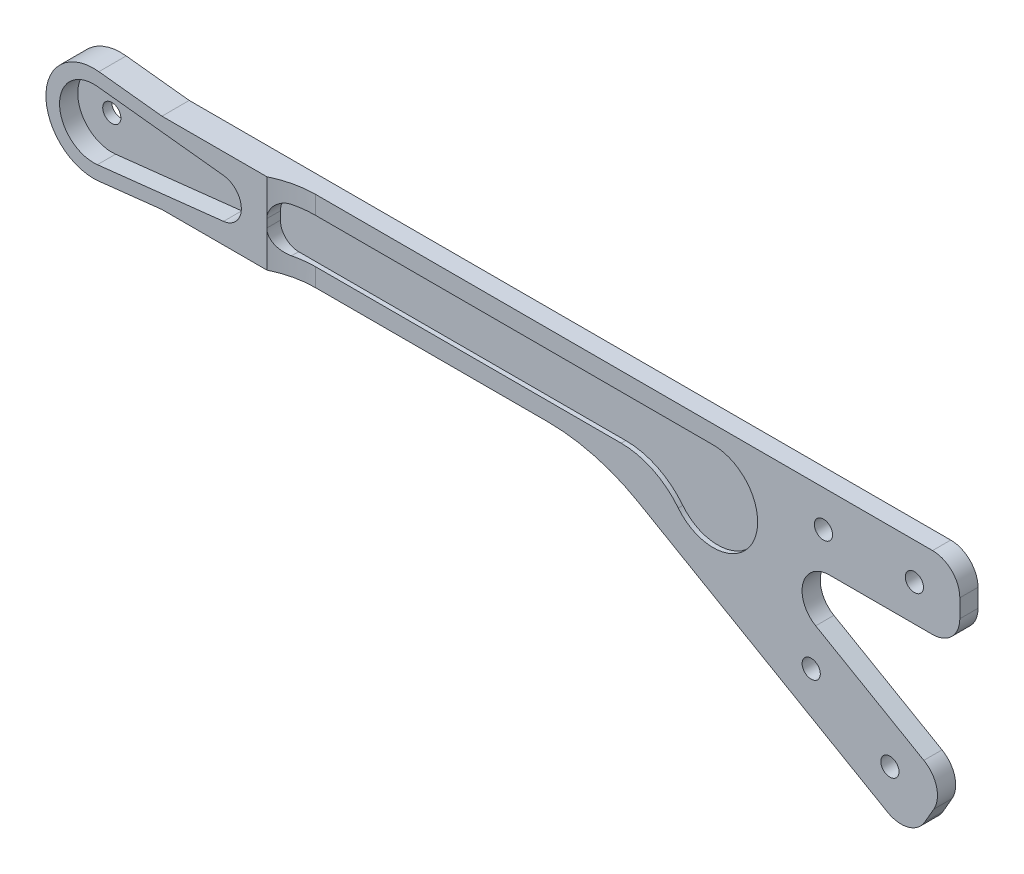
from build123d import *

# Parameters (mm, degrees)
BOSS_EXTRUDE1_DEPTH      = 2
BOSS_EXTRUDE2_DEPTH      = 1
SKETCH3_R                = 1
CUT_EXTRUDE1_DEPTH       = 1
BOSS_EXTRUDE3_DEPTH      = 2
BOSS_EXTRUDE3_DEPTH_BACK = 1
BOSS_EXTRUDE4_START      = -3
BOSS_EXTRUDE4_OUTLINE_R  = 1
BOSS_EXTRUDE4_DEPTH      = 3
SKETCH6_R                = 3.500627768
BOSS_EXTRUDE5_DEPTH      = 3
BOSS_EXTRUDE6_DEPTH      = 3
CUT_EXTRUDE2_DEPTH       = 15
FILLET1_R                = 20
FILLET2_R                = 3
FILLET3_R                = 3
SKETCH9_R                = 1
CUT_EXTRUDE3_DEPTH       = 15
CUT_EXTRUDE4_DEPTH       = 1.5
FILLET4_R                = 8
FILLET5_R                = 2
SKETCH11_W               = 110.258684369
SKETCH11_H               = 6.064888907
CUT_EXTRUDE5_DEPTH       = 38
SKETCH12_R               = 18.613151801
CUT_EXTRUDE6_DEPTH       = 29
SKETCH13_W               = 77.706478895
SKETCH13_H               = 41.021519778
CUT_EXTRUDE7_DEPTH       = 1
FILLET6_START            = -4.447684996
FILLET6_DEPTH            = 2
FILLET6_START_2          = 2.447684996
FILLET6_2_DEPTH          = 2
FILLET6_START_3          = -1
FILLET6_3_DEPTH          = 1
FILLET6_START_4          = -2.447684996
FILLET6_4_DEPTH          = 4.895369992


with BuildPart() as part:
    # Sketch1 → Boss-Extrude1 (new body)
    with BuildSketch(Plane.XY):
        with BuildLine():
            Line((14.458185053, 3.677415528), (0.579181495, 5.217954465))
            ThreePointArc((0.579181495, 5.217954465), (-5.25, 0), (0.579181495, -5.217954465))
            Line((0.579181495, -5.217954465), (14.458185053, -3.677415528))
            ThreePointArc((14.458185053, -3.677415528), (17.75, 0), (14.458185053, 3.677415528))
        make_face()
        with BuildLine():
            Line((14.292704626, 2.186571395), (0.413701068, 3.727110332))
            ThreePointArc((0.413701068, 3.727110332), (-3.75, 0), (0.413701068, -3.727110332))
            Line((0.413701068, -3.727110332), (14.292704626, -2.186571395))
            ThreePointArc((14.292704626, -2.186571395), (16.25, 0), (14.292704626, 2.186571395))
        make_face(mode=Mode.SUBTRACT)
    extrude(amount=BOSS_EXTRUDE1_DEPTH)

    # Sketch2 → Boss-Extrude2 (add)
    with BuildSketch(Plane.XY.offset(2)):
        with BuildLine():
            Line((14.458185053, 3.677415528), (0.579181495, 5.217954465))
            ThreePointArc((0.579181495, 5.217954465), (-5.25, 0), (0.579181495, -5.217954465))
            Line((0.579181495, -5.217954465), (14.458185053, -3.677415528))
            ThreePointArc((14.458185053, -3.677415528), (17.75, 0), (14.458185053, 3.677415528))
        make_face()
    extrude(amount=BOSS_EXTRUDE2_DEPTH)

    # Sketch3 → Cut-Extrude1 (cut)
    with BuildSketch(Plane.XY.offset(3)):
        Circle(SKETCH3_R)
    extrude(amount=-CUT_EXTRUDE1_DEPTH, mode=Mode.SUBTRACT)

    # Sketch4 → Boss-Extrude3 (add, two sides: drawn at the far end of the back side and taken through both)
    with BuildSketch(Plane(origin=(0, 0, 2), x_dir=(-1, 0, 0), z_dir=(0, 0, -1)).offset(-BOSS_EXTRUDE3_DEPTH_BACK)):
        with BuildLine():
            Line((-15.26072202, 2.426182253), (-7.518683274, 4.447684996))
            Line((-7.518683274, 4.447684996), (-42.518683274, 4.447684996))
            ThreePointArc((-42.518683274, 4.447684996), (-39.373695053, 3.144988221), (-38.070998278, 0))
            ThreePointArc((-38.070998278, 0), (-39.373695053, -3.144988221), (-42.518683274, -4.447684996))
            Line((-42.518683274, -4.447684996), (-7.518683274, -4.447684996))
            Line((-7.518683274, -4.447684996), (-13.862339481, -2.595687971))
            Line((-13.862339481, -2.595687971), (-16.213670101, -1.84565397))
            Line((-16.213670101, -1.84565397), (-17.166618181, 0))
            Line((-17.166618181, 0), (-15.26072202, 2.426182253))
        make_face()
        with BuildLine():
            ThreePointArc((-38.070998278, 0), (-39.373695053, 3.144988221), (-42.518683274, 4.447684996))
            Line((-42.518683274, 4.447684996), (-42.518683274, 2))
            ThreePointArc((-42.518683274, 2), (-41.104469712, 1.414213562), (-40.518683274, 0))
            ThreePointArc((-40.518683274, 0), (-41.104469712, -1.414213562), (-42.518683274, -2))
            Line((-42.518683274, -2), (-42.518683274, -4.447684996))
            ThreePointArc((-42.518683274, -4.447684996), (-39.373695053, -3.144988221), (-38.070998278, 0))
        make_face()
        with BuildLine():
            Line((-42.518683274, 2), (-42.518683274, 4.447684996))
            ThreePointArc((-42.518683274, 4.447684996), (-46.96636827, 0), (-42.518683274, -4.447684996))
            Line((-42.518683274, -4.447684996), (-42.518683274, -2))
            ThreePointArc((-42.518683274, -2), (-44.518683274, 0), (-42.518683274, 2))
        make_face()
    extrude(amount=BOSS_EXTRUDE3_DEPTH + BOSS_EXTRUDE3_DEPTH_BACK)

    # Boss-Extrude4: read off the stored shape, not the designer's step
    # Boss-Extrude4 outline → Boss-Extrude4 (add)
    with BuildSketch(Plane(origin=(0, 0, 0), x_dir=(-1, 0, 0), z_dir=(0, 0, -1)).offset(BOSS_EXTRUDE4_START)):
        with BuildLine():
            ThreePointArc((-42.518683274, -4.447684996), (-46.96636827, 0), (-42.518683274, 4.447684996))
            Line((-42.518683274, 4.447684996), (-54.290526798, 4.447684996))
            ThreePointArc((-54.290526798, 4.447684996), (-59.289068337, 5.305033813), (-63.716210719, 7.779073998))
            ThreePointArc((-63.716210719, 7.779073998), (-80, 0), (-63.716210719, -7.779073998))
            ThreePointArc((-63.716210719, -7.779073998), (-59.289068337, -5.305033813), (-54.290526798, -4.447684996))
            Line((-54.290526798, -4.447684996), (-42.518683274, -4.447684996))
        make_face()
        with Locations((-68.205771366, -4.5)):
            Circle(BOSS_EXTRUDE4_OUTLINE_R, mode=Mode.SUBTRACT)
        with Locations((-76, 0)):
            Circle(BOSS_EXTRUDE4_OUTLINE_R, mode=Mode.SUBTRACT)
        with Locations((-68.205771366, 4.5)):
            Circle(BOSS_EXTRUDE4_OUTLINE_R, mode=Mode.SUBTRACT)
    extrude(amount=BOSS_EXTRUDE4_DEPTH)

    # Sketch6 → Boss-Extrude5 (add)
    with BuildSketch(Plane(origin=(0, 0, 0), x_dir=(-1, 0, 0), z_dir=(0, 0, -1))):
        with Locations((-42.518683274, 0)):
            Circle(SKETCH6_R)
    extrude(amount=-BOSS_EXTRUDE5_DEPTH)

    # Sketch7 → Boss-Extrude6 (add)
    with BuildSketch(Plane(origin=(0, 0, 0), x_dir=(-1, 0, 0), z_dir=(0, 0, -1))):
        Polygon((-54.290526798, 4.447684996), (-94.290526798, 4.447684996), (-94.290526798, -3.552315004), (-68.73970048, -3.552315004), (-92.931542949, -17.519481766), (-88.931542949, -24.447684996), (-54.290526798, -4.447684996), align=None)
    extrude(amount=-BOSS_EXTRUDE6_DEPTH)

    # Sketch8 → Cut-Extrude2 (cut)
    with BuildSketch(Plane(origin=(0, 0, 0), x_dir=(-1, 0, 0), z_dir=(0, 0, -1))):
        Polygon((-94.290526798, 4.447684996), (-45.837456427, 4.447684996), (-68.326886593, 15.265325323), align=None)
        Polygon((-94.290526798, -3.552315004), (-68.73970048, -3.552315004), (-92.931542949, -17.519481766), align=None)
    extrude(amount=-CUT_EXTRUDE2_DEPTH, mode=Mode.SUBTRACT)

    # Fillet1
    fillet1_edges = [part.edges().sort_by_distance(p)[0] for p in [
        (54.290526798, -4.447684996, 1.5),
    ]]
    fillet(fillet1_edges, radius=FILLET1_R)

    # Fillet2
    fillet2_edges = [part.edges().sort_by_distance(p)[0] for p in [
        (94.290526798, 4.447684996, 1.5),
        (94.290526798, -3.552315004, 1.5),
        (92.931542949, -17.519481766, 1.5),
        (88.931542949, -24.447684996, 1.5),
    ]]
    fillet(fillet2_edges, radius=FILLET2_R)

    # Fillet3
    fillet3_edges = [part.edges().sort_by_distance(p)[0] for p in [
        (68.73970048, -3.552315004, 1.5),
    ]]
    fillet(fillet3_edges, radius=FILLET3_R)

    # Sketch9 → Cut-Extrude3 (cut)
    with BuildSketch(Plane(origin=(0, 0, 0), x_dir=(-1, 0, 0), z_dir=(0, 0, -1))):
        with Locations((-89.290526798, 0.447684996)):
            Circle(SKETCH9_R)
        with Locations((-79.290526798, 0.447684996)):
            Circle(SKETCH9_R)
        with Locations((-77.941161892, -13.483583381)):
            Circle(SKETCH9_R)
        with Locations((-86.60141593, -18.483583381)):
            Circle(SKETCH9_R)
    extrude(amount=-CUT_EXTRUDE3_DEPTH, mode=Mode.SUBTRACT)

    # Sketch10 → Cut-Extrude4 (cut)
    with BuildSketch(Plane(origin=(0, 0, 0), x_dir=(-1, 0, 0), z_dir=(0, 0, -1))):
        with BuildLine():
            Line((-19.05, 2.447684996), (-67.154630008, 2.447684996))
            ThreePointArc((-67.154630008, 2.447684996), (-70.616179326, -5.909234314), (-62.259260015, -2.447684996))
            Line((-62.259260015, -2.447684996), (-19.05, -2.447684996))
            Line((-19.05, -2.447684996), (-19.05, 2.447684996))
        make_face()
    extrude(amount=-CUT_EXTRUDE4_DEPTH, mode=Mode.SUBTRACT)

    # Fillet4
    fillet4_edges = [part.edges().sort_by_distance(p)[0] for p in [
        (62.259260015, -2.447684996, 0.75),
    ]]
    fillet(fillet4_edges, radius=FILLET4_R)

    # Fillet5
    fillet5_edges = [part.edges().sort_by_distance(p)[0] for p in [
        (19.05, 2.447684996, 0.75),
        (19.05, -2.447684996, 0.75),
    ]]
    fillet(fillet5_edges, radius=FILLET5_R)

    # Mirror1: part across plane


with BuildPart() as part_1:
    add(part.part)
    add(part.part.mirror(Plane(origin=(14.05, 0, 0), x_dir=(1, 0, 0), z_dir=(0, 0, 1))))

    # Sketch11 → Cut-Extrude5 (cut)
    with BuildSketch(Plane(origin=(0, 4.447684996, 0), x_dir=(1, 0, 0), z_dir=(0, 1, 0))):
        with Locations((47.771534573, -3.032444454)):
            Rectangle(SKETCH11_W, SKETCH11_H)
    extrude(amount=-CUT_EXTRUDE5_DEPTH, mode=Mode.SUBTRACT)

    # Sketch12 → Cut-Extrude6 (cut)
    with BuildSketch(Plane.XY):
        with Locations((7.534351793, 3.599902348)):
            Circle(SKETCH12_R)
    extrude(amount=CUT_EXTRUDE6_DEPTH, mode=Mode.SUBTRACT)

    # Sketch13 → Cut-Extrude7 (cut)
    with BuildSketch(Plane.XY):
        with Locations((57.903239447, -8.718962854)):
            Rectangle(SKETCH13_W, SKETCH13_H)
    extrude(amount=-CUT_EXTRUDE7_DEPTH, mode=Mode.SUBTRACT)

    # Fillet6: read off the stored shape, not the designer's step
    # Fillet6 outline → Fillet6 (add)
    with BuildSketch(Plane(origin=(0, 0, 0), x_dir=(1, 0, 0), z_dir=(0, 1, 0)).offset(FILLET6_START)):
        with BuildLine():
            Line((19.05, 1), (19.049997006, -1.45e-06))
            ThreePointArc((19.049997006, -1.45e-06), (21.172829345, 0.746793973), (23.408898944, 1))
            Line((23.408898944, 1), (19.05, 1))
        make_face()
    extrude(amount=FILLET6_DEPTH)

    # Fillet6 2 outline → Fillet6 2 (add)
    with BuildSketch(Plane(origin=(0, 0, 0), x_dir=(1, 0, 0), z_dir=(0, 1, 0)).offset(FILLET6_START_2)):
        with BuildLine():
            Line((19.05, 1), (19.049997006, -1.45e-06))
            ThreePointArc((19.049997006, -1.45e-06), (21.172829345, 0.746793973), (23.408898944, 1))
            Line((23.408898944, 1), (19.05, 1))
        make_face()
    extrude(amount=FILLET6_2_DEPTH)

    # Fillet6 3 outline → Fillet6 3 (add)
    with BuildSketch(Plane.XY.offset(FILLET6_START_3)):
        with BuildLine():
            Line((19.05, 2.447684996), (19.05, 0.447684996))
            ThreePointArc((19.05, 0.447684996), (19.635786438, 1.861898559), (21.05, 2.447684996))
            Line((21.05, 2.447684996), (19.05, 2.447684996))
        make_face()
        with BuildLine():
            ThreePointArc((21.05, -2.447684996), (19.635786438, -1.861898559), (19.05, -0.447684996))
            Line((19.05, -0.447684996), (19.05, -2.447684996))
            Line((19.05, -2.447684996), (21.05, -2.447684996))
        make_face()
    extrude(amount=FILLET6_3_DEPTH)

    # Fillet6 4 outline → Fillet6 4 (cut)
    with BuildSketch(Plane(origin=(0, 0, 0), x_dir=(1, 0, 0), z_dir=(0, 1, 0)).offset(FILLET6_START_4)):
        with BuildLine():
            ThreePointArc((23, 0.991636585), (20.973982557, 0.699029961), (19.049997006, -1.45e-06))
            Line((19.049997006, -1.45e-06), (18, -0.508538641))
            Line((18, -0.508538641), (18, -1))
            Line((18, -1), (23, -1))
            Line((23, -1), (23, 0.991636585))
        make_face()
    extrude(amount=FILLET6_4_DEPTH, mode=Mode.SUBTRACT)


solid = part_1.part
